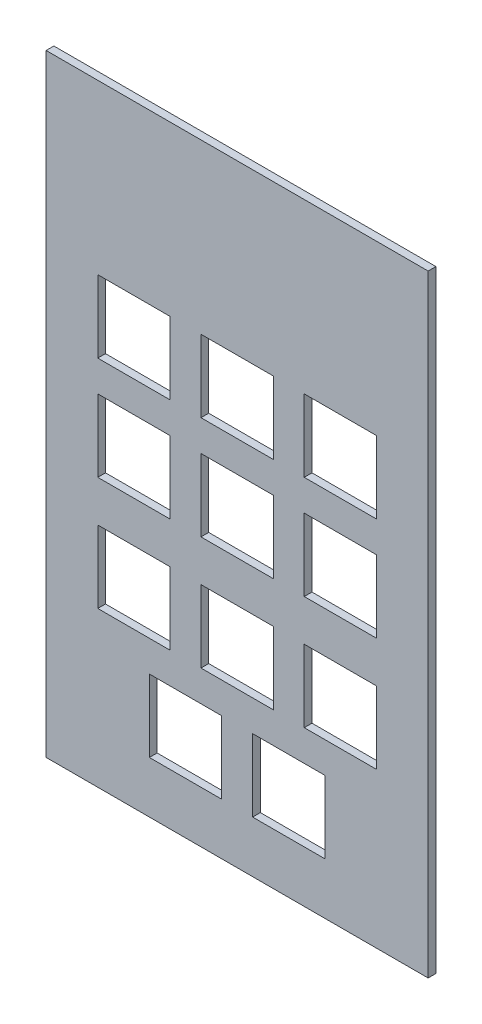
from build123d import *

# Parameters (mm, degrees)
SKETCH1_W           = 74
SKETCH1_H           = 118.61
SKETCH1_W_2         = 14
SKETCH1_H_2         = 14
BOSS_EXTRUDE1_DEPTH = 1.5


with BuildPart() as part:
    # Sketch1 → Boss-Extrude1 (new body)
    with BuildSketch(Plane.XY):
        with Locations((-37, 59.305)):
            Rectangle(SKETCH1_W, SKETCH1_H)
        with Locations((-17, 37)):
            Rectangle(SKETCH1_W_2, SKETCH1_H_2, mode=Mode.SUBTRACT)
        with Locations((-17, 79)):
            Rectangle(SKETCH1_W_2, SKETCH1_H_2, mode=Mode.SUBTRACT)
        with Locations((-37, 79)):
            Rectangle(SKETCH1_W_2, SKETCH1_H_2, mode=Mode.SUBTRACT)
        with Locations((-57, 79)):
            Rectangle(SKETCH1_W_2, SKETCH1_H_2, mode=Mode.SUBTRACT)
        with Locations((-17, 59)):
            Rectangle(SKETCH1_W_2, SKETCH1_H_2, mode=Mode.SUBTRACT)
        with Locations((-37, 59)):
            Rectangle(SKETCH1_W_2, SKETCH1_H_2, mode=Mode.SUBTRACT)
        with Locations((-57, 59)):
            Rectangle(SKETCH1_W_2, SKETCH1_H_2, mode=Mode.SUBTRACT)
        with Locations((-37, 37)):
            Rectangle(SKETCH1_W_2, SKETCH1_H_2, mode=Mode.SUBTRACT)
        with Locations((-57, 37)):
            Rectangle(SKETCH1_W_2, SKETCH1_H_2, mode=Mode.SUBTRACT)
        with Locations((-27, 17)):
            Rectangle(SKETCH1_W_2, SKETCH1_H_2, mode=Mode.SUBTRACT)
        with Locations((-47, 17)):
            Rectangle(SKETCH1_W_2, SKETCH1_H_2, mode=Mode.SUBTRACT)
    extrude(amount=BOSS_EXTRUDE1_DEPTH)


solid = part.part
